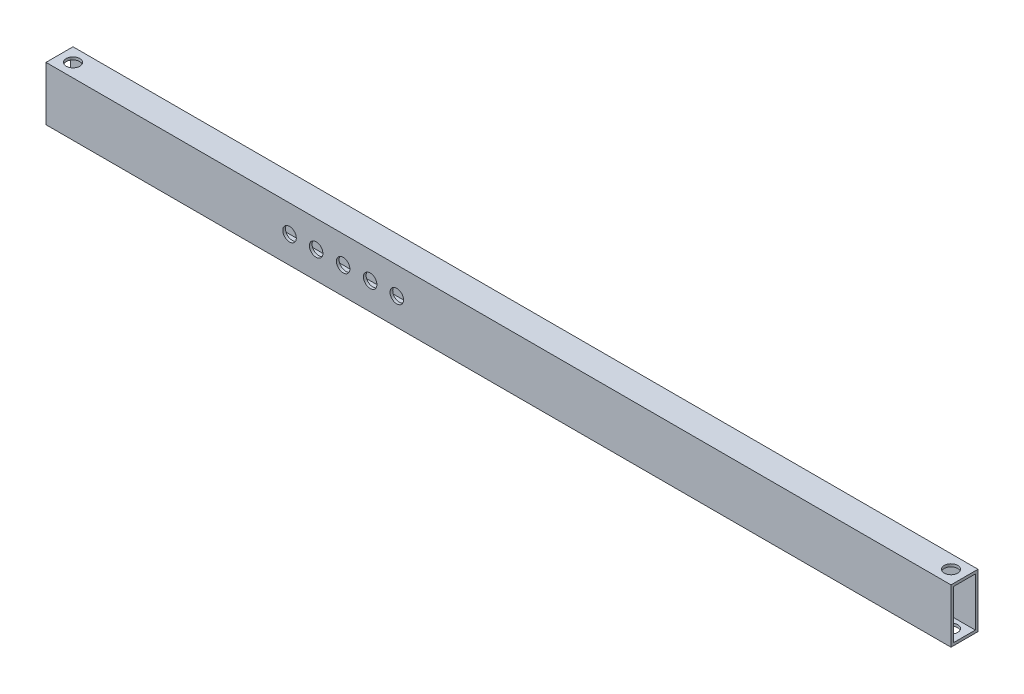
from build123d import *

# Parameters (mm, degrees)
BOSS_EXTRUDE1_DEPTH      = 225
BOSS_EXTRUDE1_DEPTH_BACK = 110
SKETCH1_W                = 10
SKETCH1_H                = 20
SKETCH1_W_2              = 8
SKETCH1_H_2              = 18
SKETCH2_R                = 2.5
CUT_EXTRUDE1_DEPTH       = 1
SKETCH3_R                = 2.5
CUT_EXTRUDE2_DEPTH       = 20


with BuildPart() as part:
    # Sketch1 → Boss-Extrude1 (new, two sides: drawn at the far end of the back side and taken through both)
    with BuildSketch(Plane(origin=(0, 0, 0), x_dir=(0, 0, -1), z_dir=(1, 0, 0)).offset(-BOSS_EXTRUDE1_DEPTH_BACK)):
        Rectangle(SKETCH1_W, SKETCH1_H)
        Rectangle(SKETCH1_W_2, SKETCH1_H_2, mode=Mode.SUBTRACT)
    extrude(amount=BOSS_EXTRUDE1_DEPTH + BOSS_EXTRUDE1_DEPTH_BACK)

    # Sketch2 → Cut-Extrude1 (cut)
    with BuildSketch(Plane.XY.offset(5)):
        with Locations((-19.85, 0)):
            Circle(SKETCH2_R)
        with Locations((-10, 0)):
            Circle(SKETCH2_R)
        Circle(SKETCH2_R)
        with Locations((19.85, 0)):
            Circle(SKETCH2_R)
        with Locations((10, 0)):
            Circle(SKETCH2_R)
    extrude(amount=-CUT_EXTRUDE1_DEPTH, mode=Mode.SUBTRACT)

    # Sketch3 → Cut-Extrude2 (cut)
    with BuildSketch(Plane(origin=(0, 10, 0), x_dir=(1, 0, 0), z_dir=(0, 1, 0))):
        with Locations((220, 0)):
            Circle(SKETCH3_R)
        with Locations((-105, 0)):
            Circle(SKETCH3_R)
    extrude(amount=-CUT_EXTRUDE2_DEPTH, mode=Mode.SUBTRACT)


solid = part.part
